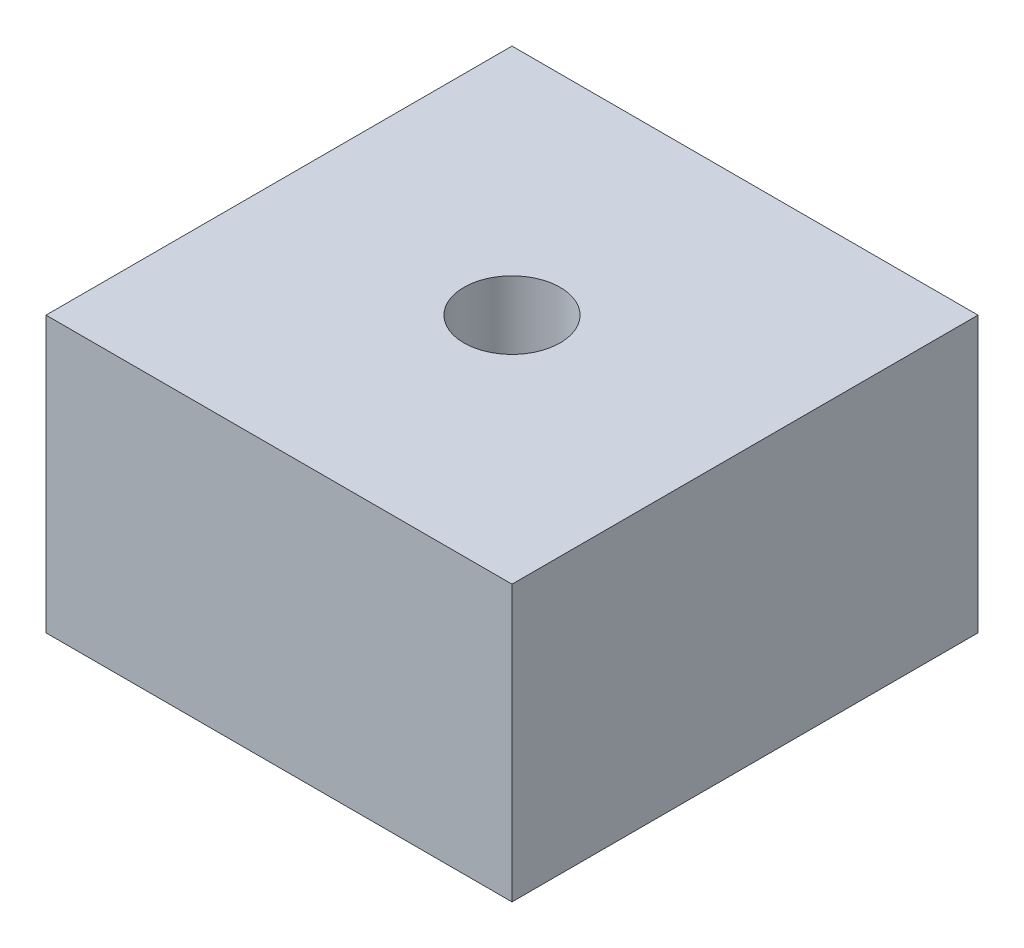
from build123d import *

# Parameters (mm, degrees)
SKETCH1_W           = 50.8
SKETCH1_H           = 50.8
SKETCH1_R           = 5.25
BOSS_EXTRUDE1_DEPTH = 30


with BuildPart() as part:
    # Sketch1 → Boss-Extrude1 (new body)
    with BuildSketch(Plane(origin=(0, 0, 0), x_dir=(1, 0, 0), z_dir=(0, 1, 0))):
        Rectangle(SKETCH1_W, SKETCH1_H)
        Circle(SKETCH1_R, mode=Mode.SUBTRACT)
    extrude(amount=BOSS_EXTRUDE1_DEPTH)


solid = part.part
